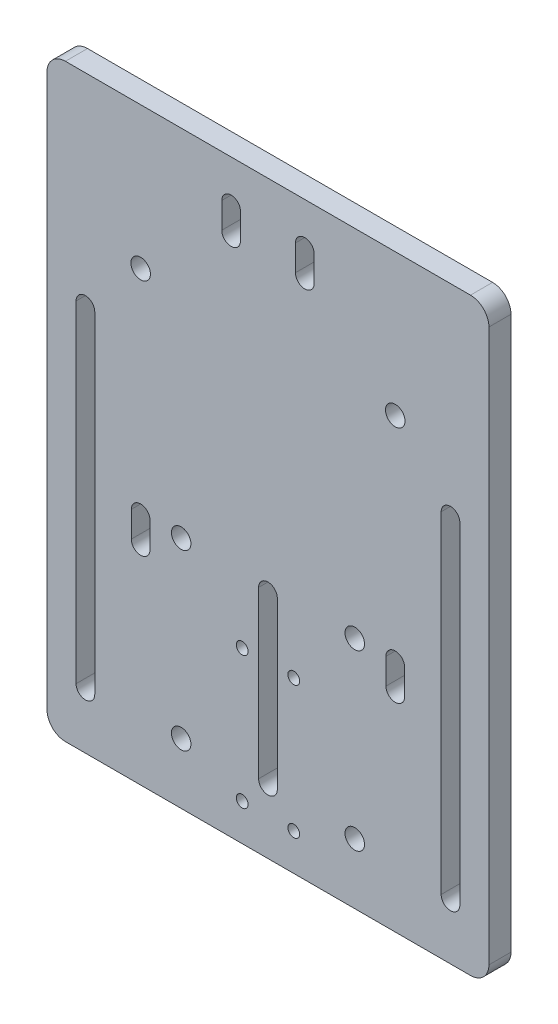
from build123d import *

# Parameters (mm, degrees)
BOSS_EXTRUDE1_DEPTH      = 6
CUT_EXTRUDE1_DEPTH       = 6
M5_CLEARANCE_HOLE1_D     = 5.3
CUT_EXTRUDE2_DEPTH       = 22
M5_CLEARANCE_HOLE2_D     = 5.3
CUT_EXTRUDE3_DEPTH       = 6
CUT_EXTRUDE4_DEPTH       = 6
M3_CLEARANCE_HOLE1_D     = 3.2
M3_CLEARANCE_HOLE1_DEPTH = 10
M3_CLEARANCE_HOLE1_TIP   = 0.96137699


with BuildPart() as part:
    # Sketch2 → Boss-Extrude1 (new body)
    with BuildSketch(Plane.XY):
        with BuildLine():
            Line((-55, -80), (55, -80))
            ThreePointArc((55, -80), (58.535533906, -78.535533906), (60, -75))
            Line((60, -75), (60, 75))
            ThreePointArc((60, 75), (58.535533906, 78.535533906), (55, 80))
            Line((55, 80), (-55, 80))
            ThreePointArc((-55, 80), (-58.535533906, 78.535533906), (-60, 75))
            Line((-60, 75), (-60, -75))
            ThreePointArc((-60, -75), (-58.535533906, -78.535533906), (-55, -80))
        make_face()
    extrude(amount=BOSS_EXTRUDE1_DEPTH)

    # Sketch3 → Cut-Extrude1 (cut)
    with BuildSketch(Plane.XY.offset(6)):
        with BuildLine():
            Line((2.54, -17.5), (2.54, -62.5))
            ThreePointArc((2.54, -62.5), (0, -65.04), (-2.54, -62.5))
            Line((-2.54, -62.5), (-2.54, -17.5))
            ThreePointArc((-2.54, -17.5), (0, -14.96), (2.54, -17.5))
        make_face()
    extrude(amount=-CUT_EXTRUDE1_DEPTH, mode=Mode.SUBTRACT)

    # M5 Clearance Hole1 (through all)
    with Locations(Plane.XY.offset(6)):
        with Locations((-23.57, -63.57), (-23.57, -16.43), (23.57, -16.43), (23.57, -63.57)):
            Hole(M5_CLEARANCE_HOLE1_D / 2)

    # Sketch6 → Cut-Extrude2 (cut)
    with BuildSketch(Plane.XY.offset(6)):
        with BuildLine():
            Line((-32.03, -16.43), (-32.03, -23.43))
            ThreePointArc((-32.03, -23.43), (-34.57, -25.97), (-37.11, -23.43))
            Line((-37.11, -23.43), (-37.11, -16.43))
            ThreePointArc((-37.11, -16.43), (-34.57, -13.89), (-32.03, -16.43))
        make_face()
    cut_extrude2 = extrude(amount=-CUT_EXTRUDE2_DEPTH, mode=Mode.SUBTRACT)

    # M5 Clearance Hole2 (through all)
    with Locations(Plane.XY.offset(6)):
        with Locations((-34.57, 41.47)):
            m5_clearance_hole2 = Hole(M5_CLEARANCE_HOLE2_D / 2)

    # Sketch9 → Cut-Extrude3 (cut)
    with BuildSketch(Plane.XY.offset(6)):
        with BuildLine():
            Line((-47.03, 25.07), (-47.03, -64.93))
            ThreePointArc((-47.03, -64.93), (-49.57, -67.47), (-52.11, -64.93))
            Line((-52.11, -64.93), (-52.11, 25.07))
            ThreePointArc((-52.11, 25.07), (-49.57, 27.61), (-47.03, 25.07))
        make_face()
    cut_extrude3 = extrude(amount=-CUT_EXTRUDE3_DEPTH, mode=Mode.SUBTRACT)

    # Mirror2: Cut-Extrude2, M5 Clearance Hole2, Cut-Extrude3 across plane
    add(cut_extrude2.mirror(Plane(origin=(0, 0, 0), x_dir=(0, 0, 1), z_dir=(1, 0, 0))), mode=Mode.SUBTRACT)
    add(m5_clearance_hole2.mirror(Plane(origin=(0, 0, 0), x_dir=(0, 0, 1), z_dir=(1, 0, 0))), mode=Mode.SUBTRACT)
    add(cut_extrude3.mirror(Plane(origin=(0, 0, 0), x_dir=(0, 0, 1), z_dir=(1, 0, 0))), mode=Mode.SUBTRACT)

    # Sketch11 → Cut-Extrude4 (cut)
    with BuildSketch(Plane.XY.offset(6)):
        with BuildLine():
            Line((-7.46, 68.5), (-7.46, 61.5))
            ThreePointArc((-7.46, 61.5), (-10, 58.96), (-12.54, 61.5))
            Line((-12.54, 61.5), (-12.54, 68.5))
            ThreePointArc((-12.54, 68.5), (-10, 71.04), (-7.46, 68.5))
        make_face()
        with BuildLine():
            Line((12.54, 68.5), (12.54, 61.5))
            ThreePointArc((12.54, 61.5), (10, 58.96), (7.46, 61.5))
            Line((7.46, 61.5), (7.46, 68.5))
            ThreePointArc((7.46, 68.5), (10, 71.04), (12.54, 68.5))
        make_face()
    extrude(amount=-CUT_EXTRUDE4_DEPTH, mode=Mode.SUBTRACT)

    # M3 Clearance Hole1
    with Locations(Plane.XY.offset(6)):
        with Locations((-7, -34), (7, -34), (7, -70), (-7, -70)):
            Hole(M3_CLEARANCE_HOLE1_D / 2, depth=M3_CLEARANCE_HOLE1_DEPTH)
            with Locations((0, 0, -(M3_CLEARANCE_HOLE1_DEPTH + M3_CLEARANCE_HOLE1_TIP / 2))):  # 118° drill point
                Cone(0, M3_CLEARANCE_HOLE1_D / 2, M3_CLEARANCE_HOLE1_TIP, mode=Mode.SUBTRACT)


solid = part.part
